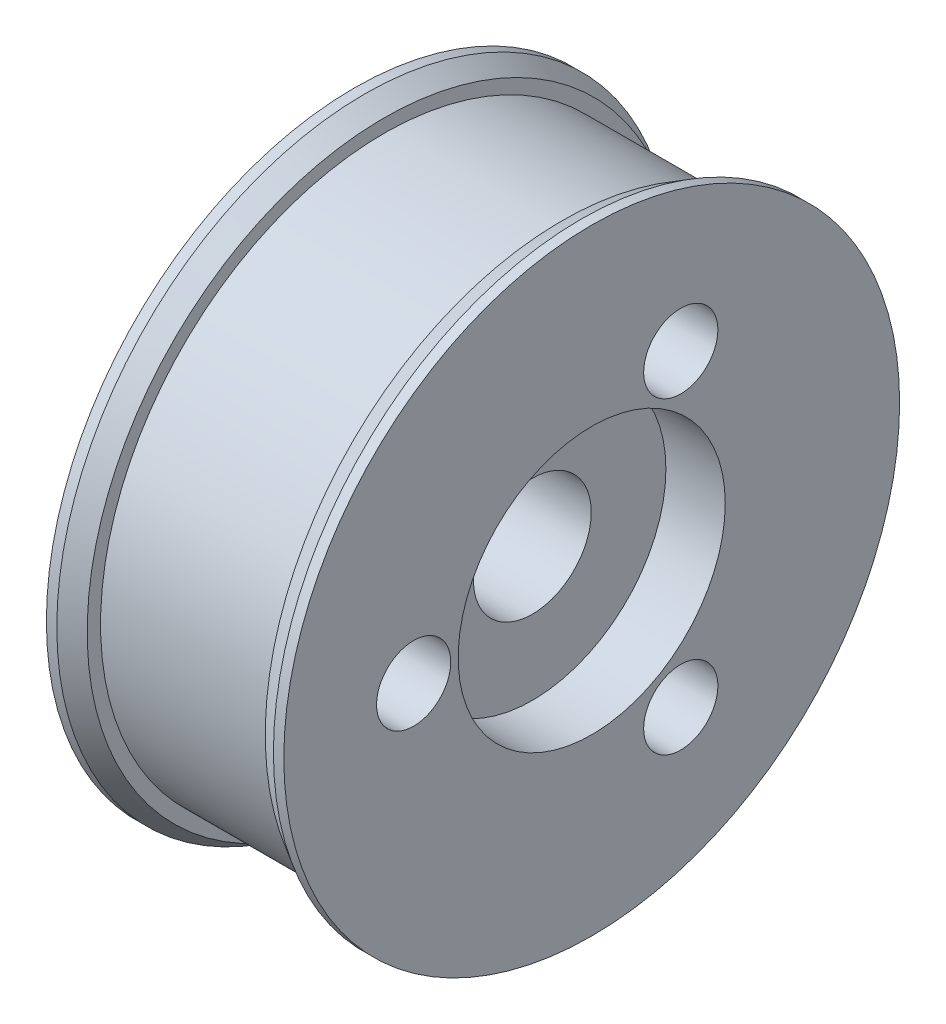
from build123d import *

# Parameters (mm, degrees)
SKETCH1_R           = 9.549296586
BOSS_EXTRUDE1_DEPTH = 6
SKETCH6_R           = 1.984375
CUT_EXTRUDE2_DEPTH  = 17.711709966
HOLE4_D             = 2.5
HOLE4_CBORE_D       = 3.5
HOLE4_CBORE_DEPTH   = 1
SKETCH5_R           = 4.5
CUT_EXTRUDE3_DEPTH  = 2


with BuildPart() as part:
    # Sketch1 → Boss-Extrude1 (new body)
    with BuildSketch(Plane.YZ):
        Circle(SKETCH1_R)
    extrude(amount=BOSS_EXTRUDE1_DEPTH)

    # Sketch4 → Revolve1 (revolve)
    with BuildSketch(Plane(origin=(0, 0, 0), x_dir=(-1, 0, 0), z_dir=(0, 1, 0))):
        Polygon((-6, 0), (-6, 10), (-6.649519053, 10.375), (-7, 10.375), (-7, 0), align=None)
        Polygon((0, 0), (1, 0), (1, 10.375), (0.649519053, 10.375), (0, 10), align=None)
    revolve(axis=Axis((9.291003126, 0, 0), (-1, 0, 0)))

    # Sketch6 → Cut-Extrude2 (cut, through all)
    with BuildSketch(Plane.YZ.offset(7)):
        Circle(SKETCH6_R)
    extrude(amount=-CUT_EXTRUDE2_DEPTH, mode=Mode.SUBTRACT)

    # Hole4 (through all)
    with Locations(Plane.ZY.offset(1)):
        with Locations((-3, 5.196152423), (-3, -5.196152423), (6, 0)):
            CounterBoreHole(HOLE4_D / 2, HOLE4_CBORE_D / 2, HOLE4_CBORE_DEPTH)

    # Sketch5 → Cut-Extrude3 (cut)
    with BuildSketch(Plane.YZ.offset(7)):
        Circle(SKETCH5_R)
    extrude(amount=-CUT_EXTRUDE3_DEPTH, mode=Mode.SUBTRACT)


solid = part.part
